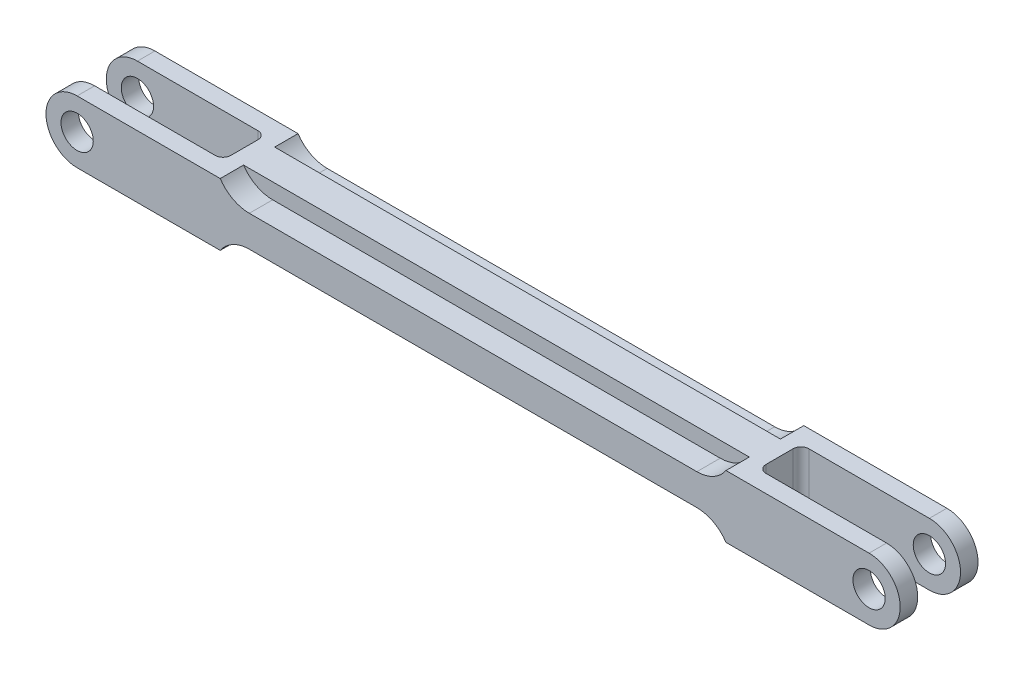
from build123d import *

# Parameters (mm, degrees)
ESBO_O1_R                = 4.15
RESSALTO_EXTRUS_O1_DEPTH = 10
ESBO_O2_W                = 41
ESBO_O2_H                = 11
CORTE_EXTRUS_O1_DEPTH    = 421.865295251
FILETE1_R                = 2
ESBO_O3_W                = 41
ESBO_O3_H                = 11
CORTE_EXTRUS_O2_DEPTH    = 421.865295251
ESBO_O4_W                = 130
ESBO_O4_H                = 51.333908156
CORTE_EXTRUS_O3_DEPTH    = 452.376336051
RESSALTO_EXTRUS_O2_DEPTH = 130
FILETE2_R                = 9
FILETE3_R                = 2


with BuildPart() as part:
    # Esboço1 → Ressalto-extrusão1 (new, symmetric)
    with BuildSketch(Plane.XY):
        with BuildLine():
            Line((208.88140452, 163), (412.442144352, 163))
            ThreePointArc((412.442144352, 163), (420.442144352, 155), (412.442144352, 147))
            Line((412.442144352, 147), (208.88140452, 147))
            ThreePointArc((208.88140452, 147), (200.88140452, 155), (208.88140452, 163))
        make_face()
        with Locations((208.88140452, 155)):
            Circle(ESBO_O1_R, mode=Mode.SUBTRACT)
        with Locations((412.442144352, 155)):
            Circle(ESBO_O1_R, mode=Mode.SUBTRACT)
    extrude(amount=RESSALTO_EXTRUS_O1_DEPTH, both=True)

    # Esboço2 → Corte-extrusão1 (cut, through all)
    with BuildSketch(Plane(origin=(0, 163, 0), x_dir=(1, 0, 0), z_dir=(0, 1, 0))):
        with Locations((221.38140452, 0)):
            Rectangle(ESBO_O2_W, ESBO_O2_H)
    extrude(amount=-CORTE_EXTRUS_O1_DEPTH, mode=Mode.SUBTRACT)

    # Filete1
    filete1_edges = [part.edges().sort_by_distance(p)[0] for p in [
        (241.88140452, 155, 5.5),
        (241.88140452, 155, -5.5),
    ]]
    fillet(filete1_edges, radius=FILETE1_R)

    # Esboço3 → Corte-extrusão2 (cut, through all)
    with BuildSketch(Plane(origin=(0, 163, 0), x_dir=(1, 0, 0), z_dir=(0, 1, 0))):
        with Locations((399.942144352, 0)):
            Rectangle(ESBO_O3_W, ESBO_O3_H)
    extrude(amount=-CORTE_EXTRUS_O2_DEPTH, mode=Mode.SUBTRACT)

    # Esboço4 → Corte-extrusão3 (cut, through all)
    with BuildSketch(Plane.XY.offset(10)):
        with Locations((310.661774436, 149.883332027)):
            Rectangle(ESBO_O4_W, ESBO_O4_H)
    extrude(amount=-CORTE_EXTRUS_O3_DEPTH, mode=Mode.SUBTRACT)


with BuildPart() as corte_extrus_o3_piece_1:
    # of the separate pieces the step leaves, piece 1, a body of its own (corte_extrus_o3_pieces)
    add(part.part.solids().sort_by_distance((241.88140452, 163, -3.5))[0])



with BuildPart() as corte_extrus_o3_piece_2:
    # of the separate pieces the step leaves, piece 2, a body of its own (corte_extrus_o3_pieces)
    add(part.part.solids().sort_by_distance((375.661774436, 163, -10))[0])


with BuildPart() as corte_extrus_o3_piece_1_1:
    add(corte_extrus_o3_piece_1.part)

    add(corte_extrus_o3_piece_2.part)  # Ressalto-extrusão2 merges Corte-extrusão3 piece 2
    # Esboço5 → Ressalto-extrusão2 (add)
    with BuildSketch(Plane(origin=(245.661774436, 0, 0), x_dir=(0, 0, -1), z_dir=(1, 0, 0))):
        Polygon((-4, 147), (-4, 151), (-10, 151), (-10, 159), (-4, 159), (-4, 163), (4, 163), (4, 159), (10, 159), (10, 151), (4, 151), (4, 147), align=None)
    extrude(amount=RESSALTO_EXTRUS_O2_DEPTH)

    # Filete2
    # the kernel refuses this fillet: 9 mm, written as the material it adds along each edge
    with BuildSketch(Plane(origin=(375.661774436, 151, -10), x_dir=(0, -1, 0), z_dir=(0, 0, 1))) as filete2_piece_1_section:
        with BuildLine():
            CenterArc((9, -7.483314774), FILETE2_R, 123.748988596, 56.251011404)
            Line((0, -7.483314774), (-0.18, -7.483314774))
            Line((-0.18, -7.483314774), (-0.18, 0))
            Line((-0.18, 0), (0, 0.18))
            ThreePointArc((0, 0.18), (2, 0.18), (3.9, 0.149666295))
            Line((3.9, 0.149666295), (4, 0))
        make_face()
    filete2_piece_1 = extrude(amount=24.708286934, mode=Mode.PRIVATE)
    filete2_piece_1 = split(filete2_piece_1, bisect_by=Plane(origin=(373.762740139, 149.968595049, 10), z_dir=(0, 0, -1)), keep=Keep.TOP, mode=Mode.PRIVATE)
    add(filete2_piece_1)
    with BuildSketch(Plane(origin=(375.661774436, 151, -14.708286934), x_dir=(0, -1, 0), z_dir=(0, 0, 1))) as filete2_piece_2_section:
        with BuildLine():
            CenterArc((9, -7.483314774), FILETE2_R, 123.748988596, 56.251011404)
            Line((0, -7.483314774), (-0.18, -7.483314774))
            Line((-0.18, -7.483314774), (-0.18, 0))
            Line((-0.18, 0), (0, 0.18))
            ThreePointArc((0, 0.18), (2, 0.18), (3.9, 0.149666295))
            Line((3.9, 0.149666295), (4, 0))
        make_face()
    filete2_piece_2 = extrude(amount=24.708286934, mode=Mode.PRIVATE)
    filete2_piece_2 = split(filete2_piece_2, bisect_by=Plane(origin=(373.762740139, 149.968595049, -10), z_dir=(0, 0, 1)), keep=Keep.TOP, mode=Mode.PRIVATE)
    add(filete2_piece_2)
    with BuildSketch(Plane(origin=(375.661774436, 159, 10), x_dir=(0, 1, 0), z_dir=(0, 0, -1))) as filete2_piece_3_section:
        with BuildLine():
            CenterArc((9, -7.483314774), FILETE2_R, 123.748988596, 56.251011404)
            Line((0, -7.483314774), (-0.18, -7.483314774))
            Line((-0.18, -7.483314774), (-0.18, 0))
            Line((-0.18, 0), (0, 0.18))
            ThreePointArc((0, 0.18), (2, 0.18), (3.9, 0.149666295))
            Line((3.9, 0.149666295), (4, 0))
        make_face()
    filete2_piece_3 = extrude(amount=24.708286934, mode=Mode.PRIVATE)
    filete2_piece_3 = split(filete2_piece_3, bisect_by=Plane(origin=(373.762740139, 160.031404951, -10), z_dir=(0, 0, 1)), keep=Keep.TOP, mode=Mode.PRIVATE)
    add(filete2_piece_3)
    with BuildSketch(Plane(origin=(375.661774436, 159, 14.708286934), x_dir=(0, 1, 0), z_dir=(0, 0, -1))) as filete2_piece_4_section:
        with BuildLine():
            CenterArc((9, -7.483314774), FILETE2_R, 123.748988596, 56.251011404)
            Line((0, -7.483314774), (-0.18, -7.483314774))
            Line((-0.18, -7.483314774), (-0.18, 0))
            Line((-0.18, 0), (0, 0.18))
            ThreePointArc((0, 0.18), (2, 0.18), (3.9, 0.149666295))
            Line((3.9, 0.149666295), (4, 0))
        make_face()
    filete2_piece_4 = extrude(amount=24.708286934, mode=Mode.PRIVATE)
    filete2_piece_4 = split(filete2_piece_4, bisect_by=Plane(origin=(373.762740139, 160.031404951, 10), z_dir=(0, 0, -1)), keep=Keep.TOP, mode=Mode.PRIVATE)
    add(filete2_piece_4)
    with BuildSketch(Plane(origin=(245.661774436, 151, -10), x_dir=(1, 0, 0), z_dir=(0, 0, 1))) as filete2_piece_5_section:
        with BuildLine():
            CenterArc((7.483314774, -9), FILETE2_R, 90, 56.251011404)
            Line((0, -4), (-0.149666295, -3.9))
            ThreePointArc((-0.149666295, -3.9), (-0.18, -2), (-0.18, 0))
            Line((-0.18, 0), (0, 0.18))
            Line((0, 0.18), (7.483314774, 0.18))
            Line((7.483314774, 0.18), (7.483314774, 0))
        make_face()
    filete2_piece_5 = extrude(amount=24.708286934, mode=Mode.PRIVATE)
    filete2_piece_5 = split(filete2_piece_5, bisect_by=Plane(origin=(247.560808733, 149.968595049, 10), z_dir=(0, 0, -1)), keep=Keep.TOP, mode=Mode.PRIVATE)
    add(filete2_piece_5)
    with BuildSketch(Plane(origin=(245.661774436, 151, -14.708286934), x_dir=(1, 0, 0), z_dir=(0, 0, 1))) as filete2_piece_6_section:
        with BuildLine():
            CenterArc((7.483314774, -9), FILETE2_R, 90, 56.251011404)
            Line((0, -4), (-0.149666295, -3.9))
            ThreePointArc((-0.149666295, -3.9), (-0.18, -2), (-0.18, 0))
            Line((-0.18, 0), (0, 0.18))
            Line((0, 0.18), (7.483314774, 0.18))
            Line((7.483314774, 0.18), (7.483314774, 0))
        make_face()
    filete2_piece_6 = extrude(amount=24.708286934, mode=Mode.PRIVATE)
    filete2_piece_6 = split(filete2_piece_6, bisect_by=Plane(origin=(247.560808733, 149.968595049, -10), z_dir=(0, 0, 1)), keep=Keep.TOP, mode=Mode.PRIVATE)
    add(filete2_piece_6)
    with BuildSketch(Plane(origin=(245.661774436, 159, 14.708286934), x_dir=(1, 0, 0), z_dir=(0, 0, -1))) as filete2_piece_7_section:
        with BuildLine():
            CenterArc((7.483314774, -9), FILETE2_R, 90, 56.251011404)
            Line((0, -4), (-0.149666295, -3.9))
            ThreePointArc((-0.149666295, -3.9), (-0.18, -2), (-0.18, 0))
            Line((-0.18, 0), (0, 0.18))
            Line((0, 0.18), (7.483314774, 0.18))
            Line((7.483314774, 0.18), (7.483314774, 0))
        make_face()
    filete2_piece_7 = extrude(amount=24.708286934, mode=Mode.PRIVATE)
    filete2_piece_7 = split(filete2_piece_7, bisect_by=Plane(origin=(247.560808733, 160.031404951, 10), z_dir=(0, 0, -1)), keep=Keep.TOP, mode=Mode.PRIVATE)
    add(filete2_piece_7)
    with BuildSketch(Plane(origin=(245.661774436, 159, 10), x_dir=(0, 1, 0), z_dir=(0, 0, -1))) as filete2_piece_8_section:
        with BuildLine():
            CenterArc((9, 7.483314774), FILETE2_R, 180, 56.251011404)
            Line((0, 7.483314774), (-0.18, 7.483314774))
            Line((-0.18, 7.483314774), (-0.18, 0))
            Line((-0.18, 0), (0, -0.18))
            ThreePointArc((0, -0.18), (2, -0.18), (3.9, -0.149666295))
            Line((3.9, -0.149666295), (4, 0))
        make_face()
    filete2_piece_8 = extrude(amount=24.708286934, mode=Mode.PRIVATE)
    filete2_piece_8 = split(filete2_piece_8, bisect_by=Plane(origin=(247.560808733, 160.031404951, -10), z_dir=(0, 0, 1)), keep=Keep.TOP, mode=Mode.PRIVATE)
    add(filete2_piece_8)

    # Filete3
    filete3_edges = [corte_extrus_o3_piece_1_1.edges().sort_by_distance(p)[0] for p in [
        (379.442144352, 155, 5.5),
        (379.442144352, 155, -5.5),
    ]]
    fillet(filete3_edges, radius=FILETE3_R)


solid = corte_extrus_o3_piece_1_1.part
